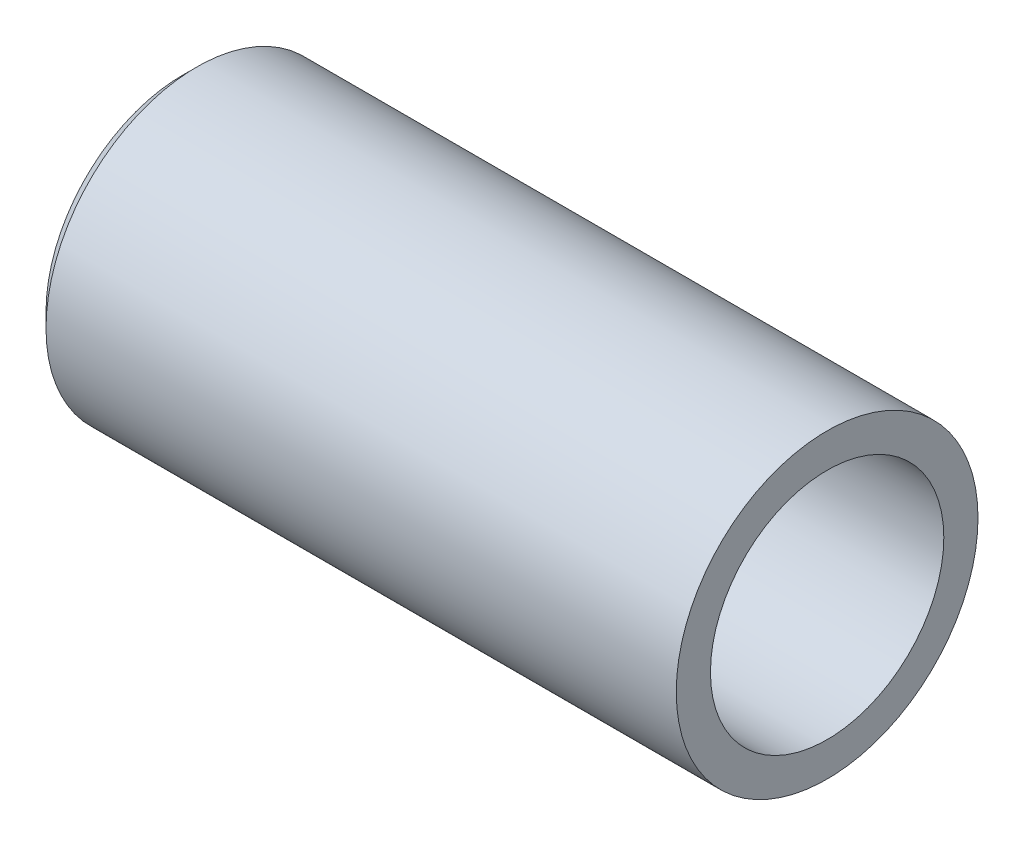
from build123d import *


with BuildPart() as part:
    # Sketch1 → Revolve1 (revolve)
    with BuildSketch(Plane.XY):
        Polygon((0.993931228, 5.295749886), (23.117875, 5.295749886), (23.117875, 4.09575), (0.496875, 4.09575), (0.496875, 4.798693658), align=None)
    revolve(axis=Axis((0, 0, 0), (1, 0, 0)))


solid = part.part
